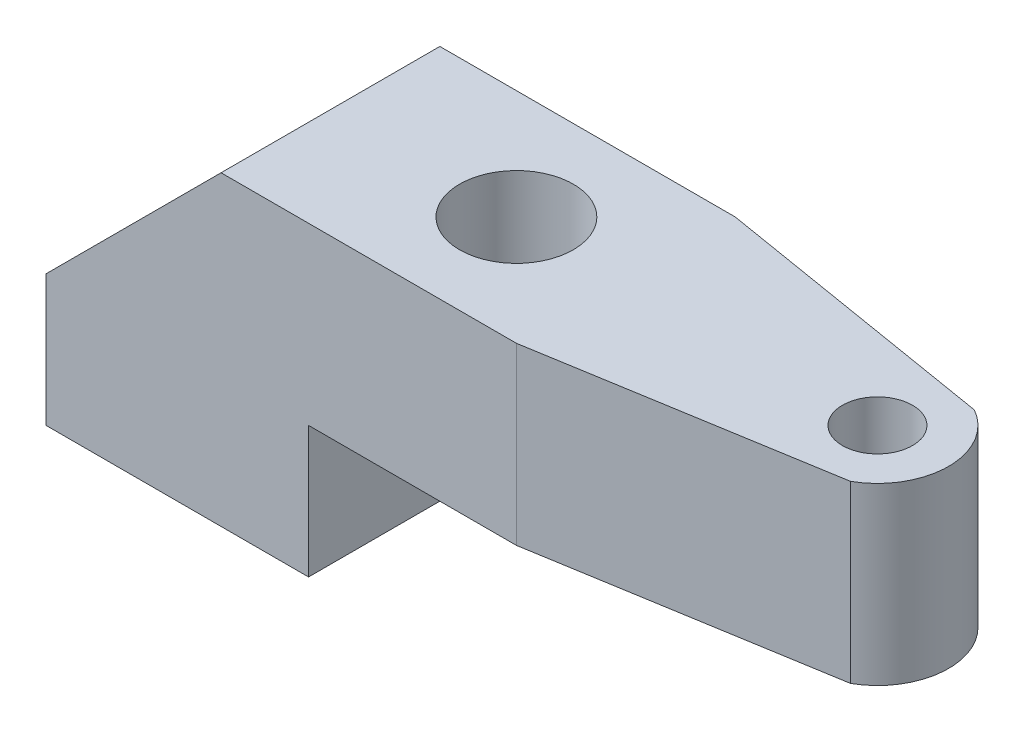
from build123d import *

# Parameters (mm, degrees)
SKETCH1_R             = 5.9875
SKETCH1_R_2           = 1.7
SKETCH1_R_3           = 1.6
BOSS_EXTRUDE1_DEPTH   = 6
MOVE_FACE1_BY         = 5
MOVE_FACE1_2_BY       = 5
MOVE_FACE1_3_BY       = 5
MOVE_FACE1_4_BY       = 5
M4X0_7_TAPPED_HOLE2_D = 3.3
POCKET_WALLS_DEPTH    = 2.6
RIB_PATTERN_DEPTH     = 3
MOVE_FACE2_BY         = 4.5
MOVE_FACE2_2_BY       = 4.5
MOVE_FACE2_3_BY       = 4.5
MOVE_FACE2_4_BY       = 4.5
MOVE_FACE2_5_BY       = 4.5
MOVE_FACE2_6_BY       = 4.5
MOVE_FACE2_7_BY       = 4.5
MOVE_FACE2_8_BY       = 4.5
MOVE_FACE2_9_BY       = 4.5
MOVE_FACE2_10_BY      = 4.5
MOVE_FACE2_11_BY      = 4.5
MOVE_FACE2_12_BY      = 4.5
MOVE_FACE2_13_BY      = 4.5
MOVE_FACE2_14_BY      = 4.5
BOSS_EXTRUDE6_REACH   = 382.427
SKETCH19_W            = 1
SKETCH19_H            = 3
BOSS_EXTRUDE7_REACH   = 375.768
SKETCH20_W            = 1
SKETCH20_H            = 3
CUT_EXTRUDE4_DEPTH    = 4.5
POCKET_FILLETS_R      = 2.5
FILLET9_R             = 3
MOVE_FACE3_BY         = 12
MOVE_FACE3_2_BY       = 12
SKETCH23_W            = 12
SKETCH23_H            = 38.175
CUT_EXTRUDE5_DEPTH    = 245.489391385
MOVE_FACE4_BY         = 4
MOVE_FACE4_2_BY       = 4
FILLET6_R             = 5
FILLET7_R             = 11
FILLET8_START         = -1
FILLET8_DEPTH         = 8
FILLET8_2_DEPTH       = 6
SKETCH25_R            = 1.6
SKETCH25_R_2          = 2.6
BOSS_EXTRUDE9_DEPTH   = 8
SKETCH26_W            = 12
SKETCH26_H            = 10
BOSS_EXTRUDE10_DEPTH  = 6
CHAMFER2_SIZE         = 8


with BuildPart() as part:
    # Sketch1 → Boss-Extrude1 (new body)
    with BuildSketch(Plane(origin=(0, 0, 0), x_dir=(1, 0, 0), z_dir=(0, 1, 0))):
        Polygon((-240, 46.25), (-198, 46.25), (-198, 26.5), (198, 26.5), (198, 46.25), (240, 46.25), (240, -18.75), (201, -18.75), (201, 0), (-201, 0), (-201, -18.75), (-240, -18.75), align=None)
        with Locations(Location((-231, 24.425, 0), (0, 0, 270))):
            Circle(SKETCH1_R, mode=Mode.SUBTRACT)
        with Locations(Location((-214.5, 37.25, 0), (0, 0, 270))):
            Circle(SKETCH1_R, mode=Mode.SUBTRACT)
        with Locations(Location((214.5, 37.25, 0), (0, 0, 90))):
            Circle(SKETCH1_R, mode=Mode.SUBTRACT)
        with Locations(Location((231, 24.425, 0), (0, 0, 90))):
            Circle(SKETCH1_R, mode=Mode.SUBTRACT)
        with Locations(Location((-204.5, -6.05, 0), (0, 0, 270))):
            Circle(SKETCH1_R_2, mode=Mode.SUBTRACT)
        with Locations(Location((-224.5, -6.05, 0), (0, 0, 270))):
            Circle(SKETCH1_R_2, mode=Mode.SUBTRACT)
        with Locations(Location((-204.5, 13.95, 0), (0, 0, 270))):
            Circle(SKETCH1_R_2, mode=Mode.SUBTRACT)
        with Locations(Location((-224.5, 13.95, 0), (0, 0, 270))):
            Circle(SKETCH1_R_2, mode=Mode.SUBTRACT)
        with Locations(Location((204.5, -6.05, 0), (0, 0, 90))):
            Circle(SKETCH1_R_2, mode=Mode.SUBTRACT)
        with Locations(Location((204.5, 13.95, 0), (0, 0, 90))):
            Circle(SKETCH1_R_2, mode=Mode.SUBTRACT)
        with Locations(Location((224.5, 13.95, 0), (0, 0, 90))):
            Circle(SKETCH1_R_2, mode=Mode.SUBTRACT)
        with Locations(Location((224.5, -6.05, 0), (0, 0, 90))):
            Circle(SKETCH1_R_2, mode=Mode.SUBTRACT)
        with Locations(Location((-187.5, 13.25, 0), (0, 0, 270))):
            Circle(SKETCH1_R_3, mode=Mode.SUBTRACT)
        with Locations(Location((-162.5, 13.25, 0), (0, 0, 270))):
            Circle(SKETCH1_R_3, mode=Mode.SUBTRACT)
        with Locations(Location((-137.5, 13.25, 0), (0, 0, 270))):
            Circle(SKETCH1_R_3, mode=Mode.SUBTRACT)
        with Locations(Location((-112.5, 13.25, 0), (0, 0, 270))):
            Circle(SKETCH1_R_3, mode=Mode.SUBTRACT)
        with Locations(Location((-87.5, 13.25, 0), (0, 0, 270))):
            Circle(SKETCH1_R_3, mode=Mode.SUBTRACT)
        with Locations(Location((-62.5, 13.25, 0), (0, 0, 270))):
            Circle(SKETCH1_R_3, mode=Mode.SUBTRACT)
        with Locations(Location((-37.5, 13.25, 0), (0, 0, 270))):
            Circle(SKETCH1_R_3, mode=Mode.SUBTRACT)
        with Locations(Location((-12.5, 13.25, 0), (0, 0, 270))):
            Circle(SKETCH1_R_3, mode=Mode.SUBTRACT)
        with Locations(Location((12.5, 13.25, 0), (0, 0, 270))):
            Circle(SKETCH1_R_3, mode=Mode.SUBTRACT)
        with Locations(Location((37.5, 13.25, 0), (0, 0, 270))):
            Circle(SKETCH1_R_3, mode=Mode.SUBTRACT)
        with Locations(Location((62.5, 13.25, 0), (0, 0, 270))):
            Circle(SKETCH1_R_3, mode=Mode.SUBTRACT)
        with Locations(Location((87.5, 13.25, 0), (0, 0, 270))):
            Circle(SKETCH1_R_3, mode=Mode.SUBTRACT)
        with Locations(Location((112.5, 13.25, 0), (0, 0, 270))):
            Circle(SKETCH1_R_3, mode=Mode.SUBTRACT)
        with Locations(Location((137.5, 13.25, 0), (0, 0, 270))):
            Circle(SKETCH1_R_3, mode=Mode.SUBTRACT)
        with Locations(Location((-231, 37.25, 0), (0, 0, 270))):
            Circle(SKETCH1_R_3, mode=Mode.SUBTRACT)
        with Locations(Location((231, 37.25, 0), (0, 0, 90))):
            Circle(SKETCH1_R_3, mode=Mode.SUBTRACT)
        with Locations(Location((162.5, 13.25, 0), (0, 0, 270))):
            Circle(SKETCH1_R_3, mode=Mode.SUBTRACT)
        with Locations(Location((187.5, 13.25, 0), (0, 0, 270))):
            Circle(SKETCH1_R_3, mode=Mode.SUBTRACT)
    extrude(amount=BOSS_EXTRUDE1_DEPTH)

    # Move Face1: a curved face moved outward by 5.0
    add(Solid.thicken(part.faces().sort_by_distance((231, 3, -18.4375))[0], MOVE_FACE1_BY))

    # Move Face1 2: a curved face moved outward by 5.0
    add(Solid.thicken(part.faces().sort_by_distance((214.5, 3, -31.2625))[0], MOVE_FACE1_2_BY))

    # Move Face1 3: a curved face moved outward by 5.0
    add(Solid.thicken(part.faces().sort_by_distance((-214.5, 3, -43.2375))[0], MOVE_FACE1_3_BY))

    # Move Face1 4: a curved face moved outward by 5.0
    add(Solid.thicken(part.faces().sort_by_distance((-231, 3, -30.4125))[0], MOVE_FACE1_4_BY))

    # M4x0.7 Tapped Hole2 (through all)
    with Locations(Plane(origin=(0, 6, 0), x_dir=(1, 0, 0), z_dir=(0, 1, 0))):
        with Locations((-214.5, 37.25), (-231, 24.425), (231, 24.425), (214.5, 37.25)):
            Hole(M4X0_7_TAPPED_HOLE2_D / 2)

    # Sketch13 → Pocket Walls (add)
    with BuildSketch(Plane.XY):
        Polygon((-214, 6), (-208.803847577, 9), (208.803847577, 9), (214, 6), align=None)
    pocket_walls = extrude(amount=-POCKET_WALLS_DEPTH)

    # Mirror1: Pocket Walls across plane
    add(pocket_walls.mirror(Plane.XY.offset(-13.25)))

    # zig_zag_style_1 → Rib Pattern (add)
    with BuildSketch(Plane(origin=(0, 6, 0), x_dir=(1, 0, 0), z_dir=(0, 1, 0))):
        Polygon((-186.851468198, 1.838812439), (-162.5, 22.586263345), (-137.5, 1.286263345), (-112.5, 22.586263345), (-87.5, 1.286263345), (-62.5, 22.586263345), (-37.5, 1.286263345), (-12.5, 22.586263345), (12.5, 1.286263345), (37.5, 22.586263345), (62.5, 1.286263345), (87.5, 22.586263345), (112.5, 1.286263345), (137.5, 22.586263345), (162.5, 1.286263345), (188.148531802, 23.138812439), (186.851468198, 24.661187561), (162.5, 3.913736655), (137.5, 25.213736655), (112.5, 3.913736655), (87.5, 25.213736655), (62.5, 3.913736655), (37.5, 25.213736655), (12.5, 3.913736655), (-12.5, 25.213736655), (-37.5, 3.913736655), (-62.5, 25.213736655), (-87.5, 3.913736655), (-112.5, 25.213736655), (-137.5, 3.913736655), (-162.5, 25.213736655), (-188.148531802, 3.361187561), align=None)
    extrude(amount=RIB_PATTERN_DEPTH)

    # Move Face2: a face moved inward by 4.5
    extrude(part.faces().sort_by_distance((162.5, 6, -17.307514961))[0], amount=MOVE_FACE2_BY, dir=(0, -1, 0), mode=Mode.SUBTRACT)

    # Move Face2 2: a face moved inward by 4.5
    extrude(part.faces().sort_by_distance((137.5, 6, -9.192485039))[0], amount=MOVE_FACE2_2_BY, dir=(0, -1, 0), mode=Mode.SUBTRACT)

    # Move Face2 3: a face moved inward by 4.5
    extrude(part.faces().sort_by_distance((112.5, 6, -17.307514961))[0], amount=MOVE_FACE2_3_BY, dir=(0, -1, 0), mode=Mode.SUBTRACT)

    # Move Face2 4: a face moved inward by 4.5
    extrude(part.faces().sort_by_distance((87.5, 6, -9.192485039))[0], amount=MOVE_FACE2_4_BY, dir=(0, -1, 0), mode=Mode.SUBTRACT)

    # Move Face2 5: a face moved inward by 4.5
    extrude(part.faces().sort_by_distance((62.5, 6, -17.307514961))[0], amount=MOVE_FACE2_5_BY, dir=(0, -1, 0), mode=Mode.SUBTRACT)

    # Move Face2 6: a face moved inward by 4.5
    extrude(part.faces().sort_by_distance((37.5, 6, -9.192485039))[0], amount=MOVE_FACE2_6_BY, dir=(0, -1, 0), mode=Mode.SUBTRACT)

    # Move Face2 7: a face moved inward by 4.5
    extrude(part.faces().sort_by_distance((12.5, 6, -17.307514961))[0], amount=MOVE_FACE2_7_BY, dir=(0, -1, 0), mode=Mode.SUBTRACT)

    # Move Face2 8: a face moved inward by 4.5
    extrude(part.faces().sort_by_distance((-12.5, 6, -9.192485039))[0], amount=MOVE_FACE2_8_BY, dir=(0, -1, 0), mode=Mode.SUBTRACT)

    # Move Face2 9: a face moved inward by 4.5
    extrude(part.faces().sort_by_distance((-37.5, 6, -17.307514961))[0], amount=MOVE_FACE2_9_BY, dir=(0, -1, 0), mode=Mode.SUBTRACT)

    # Move Face2 10: a face moved inward by 4.5
    extrude(part.faces().sort_by_distance((-62.5, 6, -9.192485039))[0], amount=MOVE_FACE2_10_BY, dir=(0, -1, 0), mode=Mode.SUBTRACT)

    # Move Face2 11: a face moved inward by 4.5
    extrude(part.faces().sort_by_distance((-87.5, 6, -17.307514961))[0], amount=MOVE_FACE2_11_BY, dir=(0, -1, 0), mode=Mode.SUBTRACT)

    # Move Face2 12: a face moved inward by 4.5
    extrude(part.faces().sort_by_distance((-112.5, 6, -9.192485039))[0], amount=MOVE_FACE2_12_BY, dir=(0, -1, 0), mode=Mode.SUBTRACT)

    # Move Face2 13: a face moved inward by 4.5
    extrude(part.faces().sort_by_distance((-162.5, 6, -9.192485039))[0], amount=MOVE_FACE2_13_BY, dir=(0, -1, 0), mode=Mode.SUBTRACT)

    # Move Face2 14: a face moved inward by 4.5
    extrude(part.faces().sort_by_distance((-137.5, 6, -17.307514961))[0], amount=MOVE_FACE2_14_BY, dir=(0, -1, 0), mode=Mode.SUBTRACT)

    # Boss-Extrude6: up to this face of the body (flat: up to its plane)
    boss_extrude6_end = Plane(part.part.faces().sort_by_distance((199.498029235, 7.445651316, -23.9))[0])
    # Sketch19 → Boss-Extrude6 (add, up to the picked face)
    with BuildSketch(Plane(origin=(120.437057913, 0, -102.612373342), x_dir=(-0.6485318015860708, 0, -0.7611875605470214), z_dir=(0.7611875605470213, 0, -0.6485318015860707)), mode=Mode.PRIVATE) as boss_extrude6_sk1:
        with Locations((-103.9073301, 7.5)):
            Rectangle(SKETCH19_W, SKETCH19_H)
    boss_extrude6_tool1 = split(extrude(boss_extrude6_sk1.sketch, amount=BOSS_EXTRUDE6_REACH, mode=Mode.PRIVATE), bisect_by=boss_extrude6_end, keep=Keep.BOTH, mode=Mode.PRIVATE)
    add(boss_extrude6_tool1.solids().sort_by(Axis((187.824266, 7.5, -23.519406), (0.7611875605470213, 0, -0.6485318015860707)))[0])

    # Boss-Extrude7: up to this face of the body (flat: up to its plane)
    boss_extrude7_end = Plane(part.part.faces().sort_by_distance((-199.498029235, 7.445651316, -2.6))[0])
    # Sketch20 → Boss-Extrude7 (add, up to the picked face)
    with BuildSketch(Plane(origin=(-107.355217903, 0, 91.466645654), x_dir=(0.6485318015860708, 0, 0.7611875605470213), z_dir=(-0.7611875605470213, 0, 0.6485318015860708)), mode=Mode.PRIVATE) as boss_extrude7_sk1:
        with Locations((-124.078800455, 7.5)):
            Rectangle(SKETCH20_W, SKETCH20_H)
    boss_extrude7_tool1 = split(extrude(boss_extrude7_sk1.sketch, amount=BOSS_EXTRUDE7_REACH, mode=Mode.PRIVATE), bisect_by=boss_extrude7_end, keep=Keep.BOTH, mode=Mode.PRIVATE)
    add(boss_extrude7_tool1.solids().sort_by(Axis((-187.824266, 7.5, -2.980594), (-0.7611875605470213, 0, 0.6485318015860708)))[0])

    # Sketch22 → Cut-Extrude4 (cut)
    with BuildSketch(Plane(origin=(0, 6, 0), x_dir=(1, 0, 0), z_dir=(0, 1, 0))):
        Polygon((-201, 2.6), (-201, 23.9), (-164.041944431, 23.9), (-189.041944431, 2.6), align=None)
        Polygon((201, 2.6), (201, 23.9), (189.041944431, 23.9), (164.041944431, 2.6), align=None)
    extrude(amount=-CUT_EXTRUDE4_DEPTH, mode=Mode.SUBTRACT)

    # Pocket FIllets
    pocket_fillets_edges = [part.edges().sort_by_distance(p)[0] for p in [
        (185.958055569, 5.25, -23.9),
        (139.041944431, 5.25, -23.9),
        (135.958055569, 5.25, -23.9),
        (89.041944431, 5.25, -23.9),
        (85.958055569, 5.25, -23.9),
        (39.041944431, 5.25, -23.9),
        (35.958055569, 5.25, -23.9),
        (-10.958055569, 5.25, -23.9),
        (-14.041944431, 5.25, -23.9),
        (-60.958055569, 5.25, -23.9),
        (-64.041944431, 5.25, -23.9),
        (-110.958055569, 5.25, -23.9),
        (-114.041944431, 5.25, -23.9),
        (-160.958055569, 5.25, -23.9),
        (-164.041944431, 5.25, -23.9),
        (164.041944431, 5.25, -2.6),
        (-185.958055569, 5.25, -2.6),
        (-139.041944431, 5.25, -2.6),
        (-135.958055569, 5.25, -2.6),
        (-89.041944431, 5.25, -2.6),
        (-85.958055569, 5.25, -2.6),
        (-39.041944431, 5.25, -2.6),
        (-35.958055569, 5.25, -2.6),
        (10.958055569, 5.25, -2.6),
        (14.041944431, 5.25, -2.6),
        (60.958055569, 5.25, -2.6),
        (64.041944431, 5.25, -2.6),
        (110.958055569, 5.25, -2.6),
        (114.041944431, 5.25, -2.6),
        (160.958055569, 5.25, -2.6),
        (137.5, 5.25, -22.586263345),
        (87.5, 5.25, -22.586263345),
        (37.5, 5.25, -22.586263345),
        (-12.5, 5.25, -22.586263345),
        (-62.5, 5.25, -22.586263345),
        (-112.5, 5.25, -22.586263345),
        (-162.5, 5.25, -22.586263345),
        (-137.5, 5.25, -3.913736655),
        (-87.5, 5.25, -3.913736655),
        (-37.5, 5.25, -3.913736655),
        (12.5, 5.25, -3.913736655),
        (62.5, 5.25, -3.913736655),
        (112.5, 5.25, -3.913736655),
        (162.5, 5.25, -3.913736655),
        (189.041944431, 5.25, -23.9),
        (-189.041944431, 5.25, -2.6),
    ]]
    fillet(pocket_fillets_edges, radius=POCKET_FILLETS_R)

    # Fillet9
    fillet9_edges = [part.edges().sort_by_distance(p)[0] for p in [
        (-201, 3.75, -2.6),
        (-201, 3.75, -23.9),
        (201, 3.75, -2.6),
        (201, 3.75, -23.9),
    ]]
    fillet(fillet9_edges, radius=FILLET9_R)

    # Move Face3: a face moved inward by 12.0
    extrude(part.faces().sort_by_distance((198, 3, -36.375))[0], amount=MOVE_FACE3_BY, dir=(1, 0, 0), mode=Mode.SUBTRACT)

    # Move Face3 2: a face moved inward by 12.0
    extrude(part.faces().sort_by_distance((-198, 3, -36.375))[0], amount=MOVE_FACE3_2_BY, dir=(-1, 0, 0), mode=Mode.SUBTRACT)

    # Sketch23 → Cut-Extrude5 (cut, through all)
    with BuildSketch(Plane(origin=(0, 6, 0), x_dir=(1, 0, 0), z_dir=(0, 1, 0))):
        with Locations((-234, 0.3375)):
            Rectangle(SKETCH23_W, SKETCH23_H)
        with Locations((234, 0.3375)):
            Rectangle(SKETCH23_W, SKETCH23_H)
    extrude(amount=-CUT_EXTRUDE5_DEPTH, mode=Mode.SUBTRACT)

    # Move Face4: a face moved inward by 4.0
    extrude(part.faces().sort_by_distance((-240, 3, -32.8375))[0], amount=MOVE_FACE4_BY, dir=(1, 0, 0), mode=Mode.SUBTRACT)

    # Move Face4 2: a face moved inward by 4.0
    extrude(part.faces().sort_by_distance((240, 3, -32.8375))[0], amount=MOVE_FACE4_2_BY, dir=(-1, 0, 0), mode=Mode.SUBTRACT)

    # Fillet6
    fillet6_edges = [part.edges().sort_by_distance(p)[0] for p in [
        (-210, 3, -46.25),
        (-210, 3, -26.5),
        (210, 3, -26.5),
        (210, 3, -46.25),
        (201, 3, 18.75),
        (201, 3, 0),
        (-201, 3, 0),
        (-201, 3, 18.75),
        (-228, 3, 18.75),
        (228, 3, 18.75),
    ]]
    fillet(fillet6_edges, radius=FILLET6_R)

    # Fillet7
    fillet7_edges = [part.edges().sort_by_distance(p)[0] for p in [
        (-236, 3, -46.25),
        (236, 3, -46.25),
    ]]
    fillet(fillet7_edges, radius=FILLET7_R)

    # Fillet8: read off the stored shape, not the designer's step
    # Fillet8 outline → Fillet8 (cut)
    with BuildSketch(Plane(origin=(0, 0, 0), x_dir=(1, 0, 0), z_dir=(0, 1, 0)).offset(FILLET8_START)):
        with BuildLine():
            Line((-236, 19.425), (-232, 19.425))
            ThreePointArc((-232, 19.425), (-234.828427125, 20.596572875), (-236, 23.425))
            Line((-236, 23.425), (-236, 19.425))
        make_face()
        with BuildLine():
            ThreePointArc((236, 23.425), (234.828427125, 20.596572875), (232, 19.425))
            Line((232, 19.425), (236, 19.425))
            Line((236, 19.425), (236, 23.425))
        make_face()
    extrude(amount=FILLET8_DEPTH, mode=Mode.SUBTRACT)

    # Fillet8 2 outline → Fillet8 2 (add)
    with BuildSketch(Plane(origin=(0, 0, 0), x_dir=(1, 0, 0), z_dir=(0, 1, 0))):
        with BuildLine():
            Line((-228, 19.425), (-232, 19.425))
            ThreePointArc((-232, 19.425), (-229.171572875, 18.253427125), (-228, 15.425))
            Line((-228, 15.425), (-228, 19.425))
        make_face()
        with BuildLine():
            Line((228, 19.425), (228, 15.425))
            ThreePointArc((228, 15.425), (229.171572875, 18.253427125), (232, 19.425))
            Line((232, 19.425), (228, 19.425))
        make_face()
    extrude(amount=FILLET8_2_DEPTH)


with BuildPart() as body_2:
    # Sketch25 → Boss-Extrude9 (new body)
    with BuildSketch(Plane(origin=(0, 6, 0), x_dir=(1, 0, 0), z_dir=(0, 1, 0))):
        with BuildLine():
            Line((198, 32.25), (198, 42.25))
            Line((198, 42.25), (219.5, 42.25))
            Line((219.5, 42.25), (232.6, 40.078869032))
            ThreePointArc((232.6, 40.078869032), (234.25, 37.25), (232.6, 34.421130968))
            Line((232.6, 34.421130968), (219.5, 32.25))
            Line((219.5, 32.25), (198, 32.25))
        make_face()
        with Locations(Location((231, 37.25, 0), (0, 0, 270))):
            Circle(SKETCH25_R, mode=Mode.SUBTRACT)
        with Locations(Location((214.5, 37.25, 0), (0, 0, 270))):
            Circle(SKETCH25_R_2, mode=Mode.SUBTRACT)
    extrude(amount=BOSS_EXTRUDE9_DEPTH)

    # Sketch26 → Boss-Extrude10 (add)
    with BuildSketch(Plane.XZ.offset(-6)):
        with Locations((204, -37.25)):
            Rectangle(SKETCH26_W, SKETCH26_H)
    extrude(amount=BOSS_EXTRUDE10_DEPTH)

    # Chamfer2
    chamfer2_edges = [body_2.edges().sort_by_distance(p)[0] for p in [
        (198, 14, -37.25),
    ]]
    chamfer(chamfer2_edges, length=CHAMFER2_SIZE)


solid = body_2.part
